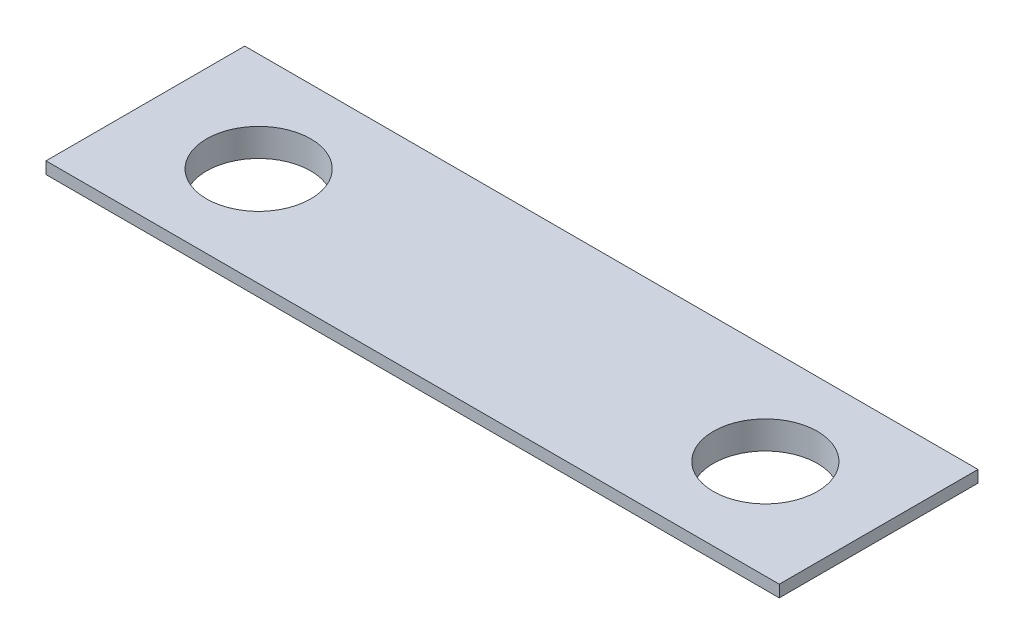
from build123d import *

# Parameters (mm, degrees)
SKETCH1_W           = 92.236
SKETCH1_H           = 25
SKETCH1_R           = 6.55
BOSS_EXTRUDE1_DEPTH = 1.5
BOSS_EXTRUDE2_START = 2
SKETCH2_R           = 10
SKETCH2_R_2         = 6.55
BOSS_EXTRUDE2_DEPTH = 2


with BuildPart() as part:
    # Sketch1 → Boss-Extrude1 (new body)
    with BuildSketch(Plane(origin=(0, 0, 0), x_dir=(1, 0, 0), z_dir=(0, 1, 0))):
        Rectangle(SKETCH1_W, SKETCH1_H)
        with Locations((-31.868, 0)):
            Circle(SKETCH1_R, mode=Mode.SUBTRACT)
        with Locations((31.868, 0)):
            Circle(SKETCH1_R, mode=Mode.SUBTRACT)
    extrude(amount=BOSS_EXTRUDE1_DEPTH)

    # Sketch2 → Boss-Extrude2 (add)
    # profile 1 of 2: a face of its own
    with BuildSketch(Plane.XZ.offset(BOSS_EXTRUDE2_START)):
        with Locations((-31.868, 0)):
            Circle(SKETCH2_R)
        with Locations((-31.868, 0)):
            Circle(SKETCH2_R_2, mode=Mode.SUBTRACT)
    # profile 2 of 2: a face of its own
    with BuildSketch(Plane.XZ.offset(BOSS_EXTRUDE2_START)):
        with Locations((31.868, 0)):
            Circle(SKETCH2_R)
        with Locations((31.868, 0)):
            Circle(SKETCH2_R_2, mode=Mode.SUBTRACT)
    extrude(amount=-BOSS_EXTRUDE2_DEPTH)


solid = part.part
